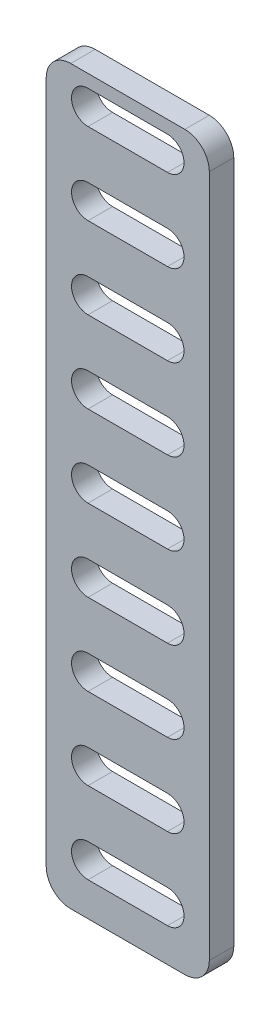
from build123d import *

# Parameters (mm, degrees)
SKETCH1_W           = 20
SKETCH1_H           = 89.778025726
BOSS_EXTRUDE1_DEPTH = 3
FILLET1_R           = 3


with BuildPart() as part:
    # Sketch1 → Boss-Extrude1 (new body)
    with BuildSketch(Plane.XY):
        with Locations((-91.066816784, 78.797568057)):
            Rectangle(SKETCH1_W, SKETCH1_H)
        with BuildLine():
            Line((-86.19596438, 38.053580074), (-95.937669189, 38.053580074))
            ThreePointArc((-95.937669189, 38.053580074), (-97.965327886, 40.081238771), (-95.937669189, 42.108897468))
            Line((-95.937669189, 42.108897468), (-86.19596438, 42.108897468))
            ThreePointArc((-86.19596438, 42.108897468), (-84.168305683, 40.081238771), (-86.19596438, 38.053580074))
        make_face(mode=Mode.SUBTRACT)
        with BuildLine():
            Line((-86.19596438, 48.053580074), (-95.937669189, 48.053580074))
            ThreePointArc((-95.937669189, 48.053580074), (-97.965327886, 50.081238771), (-95.937669189, 52.108897468))
            Line((-95.937669189, 52.108897468), (-86.19596438, 52.108897468))
            ThreePointArc((-86.19596438, 52.108897468), (-84.168305683, 50.081238771), (-86.19596438, 48.053580074))
        make_face(mode=Mode.SUBTRACT)
        with BuildLine():
            Line((-86.19596438, 58.053580074), (-95.937669189, 58.053580074))
            ThreePointArc((-95.937669189, 58.053580074), (-97.965327886, 60.081238771), (-95.937669189, 62.108897468))
            Line((-95.937669189, 62.108897468), (-86.19596438, 62.108897468))
            ThreePointArc((-86.19596438, 62.108897468), (-84.168305683, 60.081238771), (-86.19596438, 58.053580074))
        make_face(mode=Mode.SUBTRACT)
        with BuildLine():
            Line((-86.19596438, 68.053580074), (-95.937669189, 68.053580074))
            ThreePointArc((-95.937669189, 68.053580074), (-97.965327886, 70.081238771), (-95.937669189, 72.108897468))
            Line((-95.937669189, 72.108897468), (-86.19596438, 72.108897468))
            ThreePointArc((-86.19596438, 72.108897468), (-84.168305683, 70.081238771), (-86.19596438, 68.053580074))
        make_face(mode=Mode.SUBTRACT)
        with BuildLine():
            Line((-86.19596438, 78.053580074), (-95.937669189, 78.053580074))
            ThreePointArc((-95.937669189, 78.053580074), (-97.965327886, 80.081238771), (-95.937669189, 82.108897468))
            Line((-95.937669189, 82.108897468), (-86.19596438, 82.108897468))
            ThreePointArc((-86.19596438, 82.108897468), (-84.168305683, 80.081238771), (-86.19596438, 78.053580074))
        make_face(mode=Mode.SUBTRACT)
        with BuildLine():
            Line((-86.19596438, 88.053580074), (-95.937669189, 88.053580074))
            ThreePointArc((-95.937669189, 88.053580074), (-97.965327886, 90.081238771), (-95.937669189, 92.108897468))
            Line((-95.937669189, 92.108897468), (-86.19596438, 92.108897468))
            ThreePointArc((-86.19596438, 92.108897468), (-84.168305683, 90.081238771), (-86.19596438, 88.053580074))
        make_face(mode=Mode.SUBTRACT)
        with BuildLine():
            Line((-86.19596438, 98.053580074), (-95.937669189, 98.053580074))
            ThreePointArc((-95.937669189, 98.053580074), (-97.965327886, 100.081238771), (-95.937669189, 102.108897468))
            Line((-95.937669189, 102.108897468), (-86.19596438, 102.108897468))
            ThreePointArc((-86.19596438, 102.108897468), (-84.168305683, 100.081238771), (-86.19596438, 98.053580074))
        make_face(mode=Mode.SUBTRACT)
        with BuildLine():
            Line((-86.19596438, 108.053580074), (-95.937669189, 108.053580074))
            ThreePointArc((-95.937669189, 108.053580074), (-97.965327886, 110.081238771), (-95.937669189, 112.108897468))
            Line((-95.937669189, 112.108897468), (-86.19596438, 112.108897468))
            ThreePointArc((-86.19596438, 112.108897468), (-84.168305683, 110.081238771), (-86.19596438, 108.053580074))
        make_face(mode=Mode.SUBTRACT)
        with BuildLine():
            Line((-86.19596438, 118.053580074), (-95.937669189, 118.053580074))
            ThreePointArc((-95.937669189, 118.053580074), (-97.965327886, 120.081238771), (-95.937669189, 122.108897468))
            Line((-95.937669189, 122.108897468), (-86.19596438, 122.108897468))
            ThreePointArc((-86.19596438, 122.108897468), (-84.168305683, 120.081238771), (-86.19596438, 118.053580074))
        make_face(mode=Mode.SUBTRACT)
    extrude(amount=BOSS_EXTRUDE1_DEPTH)

    # Fillet1
    fillet1_edges = [part.edges().sort_by_distance(p)[0] for p in [
        (-101.066816784, 123.68658092, 1.5),
        (-81.066816784, 123.68658092, 1.5),
        (-101.066816784, 33.908555194, 1.5),
        (-81.066816784, 33.908555194, 1.5),
    ]]
    fillet(fillet1_edges, radius=FILLET1_R)


solid = part.part
